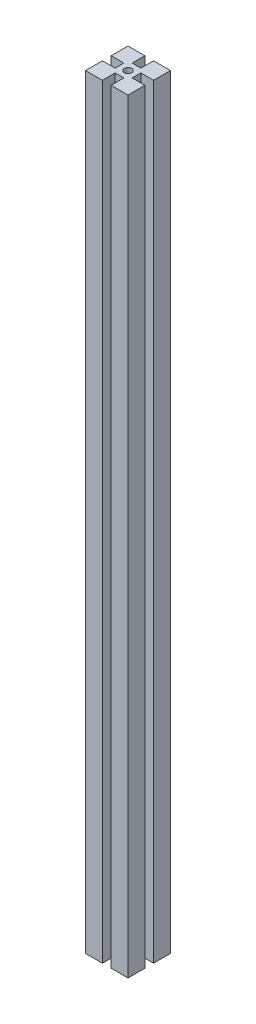
from build123d import *

# Parameters (mm, degrees)
SKIZZE1_R                       = 3.5
AUFSATZ_LINEAR_AUSTRAGEN1_DEPTH = 720


with BuildPart() as part:
    # Skizze1 → Aufsatz-Linear austragen1 (new body)
    with BuildSketch(Plane(origin=(0, 0, 0), x_dir=(1, 0, 0), z_dir=(0, 1, 0))):
        Polygon((-4.1, -20), (-4.1, -8), (4.1, -8), (4.1, -20), (20, -20), (20, -4.1), (8, -4.1), (8, 4.1), (20, 4.1), (20, 20), (4.1, 20), (4.1, 8), (-4.1, 8), (-4.1, 20), (-20, 20), (-20, 4.1), (-8, 4.1), (-8, -4.1), (-20, -4.1), (-20, -20), align=None)
        Circle(SKIZZE1_R, mode=Mode.SUBTRACT)
    extrude(amount=AUFSATZ_LINEAR_AUSTRAGEN1_DEPTH)


solid = part.part
